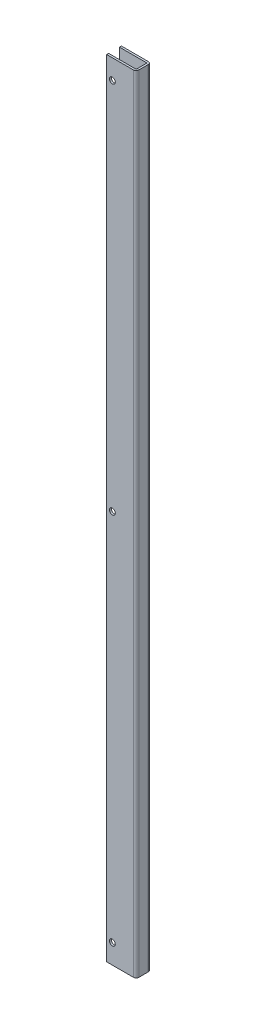
from build123d import *

# Parameters (mm, degrees)
SKETCH1_W                    = 30
SKETCH1_H                    = 800
BASE_FLANGE1_DEPTH           = 2
EDGE_FLANGE1_STRIP_W         = 9.4732
EDGE_FLANGE1_STRIP_H         = 2
EDGE_FLANGE1_STRIP_CUT_DEPTH = 800
EDGE_FLANGE1_DEPTH           = 800
EDGE_FLANGE2_STRIP_W         = 9.4732
EDGE_FLANGE2_STRIP_H         = 2
EDGE_FLANGE2_STRIP_CUT_DEPTH = 800
EDGE_FLANGE2_DEPTH           = 800
SKETCH12_R                   = 3
CUT_EXTRUDE1_DEPTH           = 401.562105047


# Sheet-metal steps are written as plain solids
with BuildPart() as part:
    # Sketch1 → Base-Flange1 (new body)
    with BuildSketch(Plane.XY):
        Rectangle(SKETCH1_W, SKETCH1_H)
    extrude(amount=-BASE_FLANGE1_DEPTH)

    # Edge-Flange1 strip (across the edge) → Edge-Flange1 strip cut (cut)
    with BuildSketch(Plane(origin=(15, -400, 0), x_dir=(-1, 0, 0), z_dir=(0, 1, 0))):
        with Locations((-2, -1)):
            Rectangle(EDGE_FLANGE1_STRIP_W, EDGE_FLANGE1_STRIP_H)
    extrude(amount=EDGE_FLANGE1_STRIP_CUT_DEPTH, mode=Mode.SUBTRACT)

    # Edge-Flange1 section (across the edge) → Edge-Flange1 (add)
    with BuildSketch(Plane(origin=(15, -400, 0), x_dir=(-1, 0, 0), z_dir=(0, 1, 0))):
        with BuildLine():
            Line((0, 0.7366), (0, 13))
            Line((0, 13), (2, 13))
            Line((2, 13), (2, 0.7366))
            ThreePointArc((2, 0.7366), (2.215745145, 0.215745145), (2.7366, 0))
            Line((2.7366, 0), (2.7366, -2))
            ThreePointArc((2.7366, -2), (0.801531583, -1.198468417), (0, 0.7366))
        make_face()
    extrude(amount=EDGE_FLANGE1_DEPTH)

    # Edge-Flange2 strip (across the edge) → Edge-Flange2 strip cut (cut)
    with BuildSketch(Plane(origin=(13, -400, 13), x_dir=(0, 0, -1), z_dir=(0, 1, 0))):
        with Locations((-2, -1)):
            Rectangle(EDGE_FLANGE2_STRIP_W, EDGE_FLANGE2_STRIP_H)
    extrude(amount=EDGE_FLANGE2_STRIP_CUT_DEPTH, mode=Mode.SUBTRACT)

    # Edge-Flange2 section (across the edge) → Edge-Flange2 (add)
    with BuildSketch(Plane(origin=(13, -400, 13), x_dir=(0, 0, -1), z_dir=(0, 1, 0))):
        with BuildLine():
            Line((0, 0.7366), (0, 28))
            Line((0, 28), (2, 28))
            Line((2, 28), (2, 0.7366))
            ThreePointArc((2, 0.7366), (2.215745145, 0.215745145), (2.7366, 0))
            Line((2.7366, 0), (2.7366, -2))
            ThreePointArc((2.7366, -2), (0.801531583, -1.198468417), (0, 0.7366))
        make_face()
    extrude(amount=EDGE_FLANGE2_DEPTH)

    # Sketch12 → Cut-Extrude1 (cut, through all)
    with BuildSketch(Plane(origin=(0, 0, -2), x_dir=(-1, 0, 0), z_dir=(0, 0, -1))):
        with Locations(Location((9.26, 380, 0), (0, 0, 90))):
            Circle(SKETCH12_R)
        with Locations(Location((9.26, 0, 0), (0, 0, 90))):
            Circle(SKETCH12_R)
        with Locations(Location((9.26, -380, 0), (0, 0, 90))):
            Circle(SKETCH12_R)
    extrude(amount=-CUT_EXTRUDE1_DEPTH, mode=Mode.SUBTRACT)


solid = part.part
